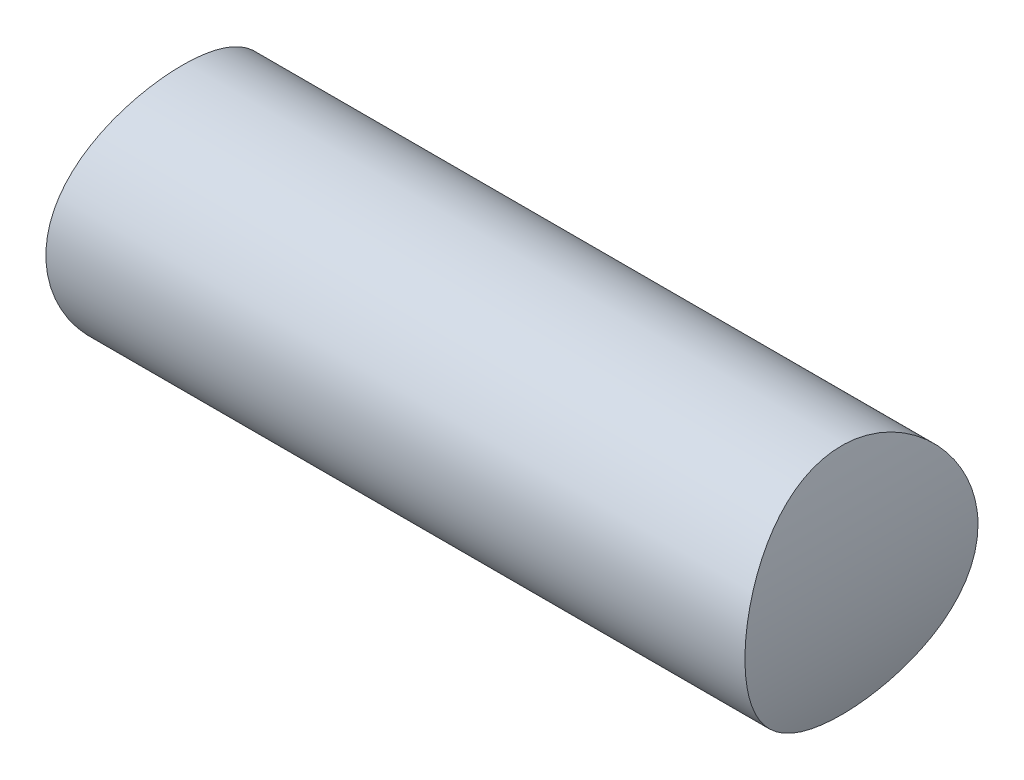
from build123d import *

# Parameters (mm, degrees)
SKETCH1_W          = 15
SKETCH1_H          = 2.5
CUT_EXTRUDE1_START = -2.500000104
CUT_EXTRUDE1_DEPTH = 5.000000104


# Read off the part's stored shape, not the designer's step: Cut-Extrude1
with BuildPart() as part:
    # Sketch1 → Revolve1 (revolve)
    with BuildSketch(Plane.XY, mode=Mode.PRIVATE) as revolve1_sk:
        with Locations((7.5, 1.25)):
            Rectangle(SKETCH1_W, SKETCH1_H)
    revolve(revolve1_sk.sketch.rotate(Axis((0, 0, 0), (-1, 0, 0)), 90), axis=Axis((0, 0, 0), (-1, 0, 0)))

    # Cut-Extrude1 outline → Cut-Extrude1 (cut)
    with BuildSketch(Plane.XY.offset(CUT_EXTRUDE1_START)):
        with BuildLine():
            ThreePointArc((15, 0), (14.891942024, -1.268539759), (14.570881835, -2.500525961))
            Line((14.570881835, -2.500525961), (14.040612224, -4))
            Line((14.040612224, -4), (15, -4))
            Line((15, -4), (15, 0))
        make_face()
        with BuildLine():
            ThreePointArc((14.570881835, 2.500525961), (14.891942024, 1.268539759), (15, 0))
            Line((15, 0), (15, 4))
            Line((15, 4), (14.040612224, 4))
            Line((14.040612224, 4), (14.570881835, 2.500525961))
        make_face()
        with BuildLine():
            Line((0, -4), (0.959302832, -4))
            Line((0.959302832, -4), (0.428992279, -2.500169957))
            ThreePointArc((0.428992279, -2.500169957), (0.108026045, -1.268353676), (0, -1e-09))
            Line((0, -1e-09), (0, -4))
        make_face()
        with BuildLine():
            Line((0.428990761, 2.500165664), (0.959301807, 4))
            Line((0.959301807, 4), (0, 4))
            Line((0, 4), (0, -1e-09))
            ThreePointArc((0, -1e-09), (0.10802566, 1.268351432), (0.428990761, 2.500165664))
        make_face()
    extrude(amount=CUT_EXTRUDE1_DEPTH, mode=Mode.SUBTRACT)


solid = part.part
